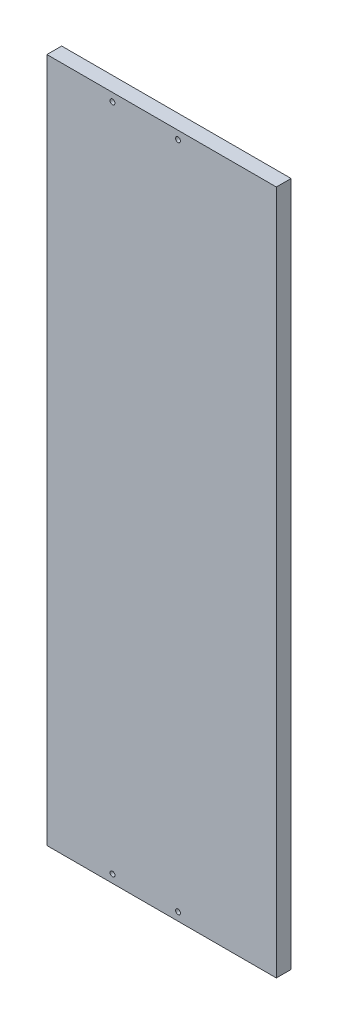
from build123d import *

# Parameters (mm, degrees)
SKETCH_1_W      = 140
SKETCH_1_H      = 418
SKETCH_1_R      = 1.5
EXTRUDE_1_DEPTH = 9


with BuildPart() as part:
    # Эскиз1 → Бобышка-Вытянуть1 (new body)
    with BuildSketch(Plane.XY.offset(9)):
        with Locations((70, 209)):
            Rectangle(SKETCH_1_W, SKETCH_1_H)
        with Locations((80, 413)):
            Circle(SKETCH_1_R, mode=Mode.SUBTRACT)
        with Locations((40, 413)):
            Circle(SKETCH_1_R, mode=Mode.SUBTRACT)
        with Locations((40, 5)):
            Circle(SKETCH_1_R, mode=Mode.SUBTRACT)
        with Locations((80, 5)):
            Circle(SKETCH_1_R, mode=Mode.SUBTRACT)
    extrude(amount=-EXTRUDE_1_DEPTH)


solid = part.part
